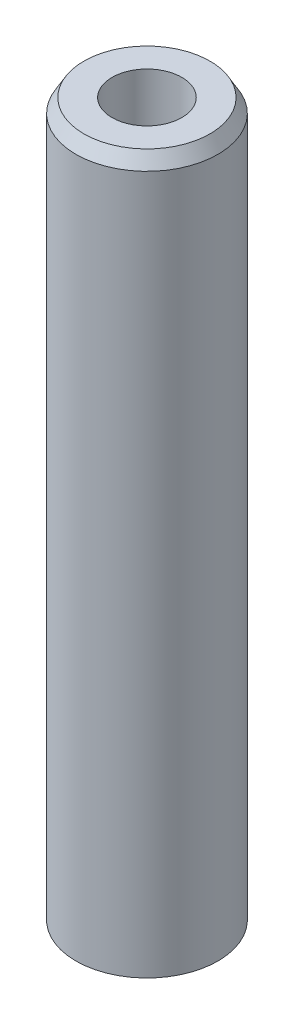
from build123d import *
from OCP.BRepFilletAPI import BRepFilletAPI_MakeChamfer

# Parameters (mm, degrees)
SKETCH1_R           = 10
BOSS_EXTRUDE1_DEPTH = 101.453979882
SKETCH2_R           = 4.914323069
CUT_EXTRUDE1_DEPTH  = 103.434906325
CHAMFER1_SIZE       = 1.940346507
CHAMFER1_SIZE2      = 1.120259578


with BuildPart() as part:
    # Sketch1 → Boss-Extrude1 (new body)
    with BuildSketch(Plane(origin=(0, 0, 0), x_dir=(1, 0, 0), z_dir=(0, 1, 0))):
        Circle(SKETCH1_R)
    extrude(amount=BOSS_EXTRUDE1_DEPTH)

    # Sketch2 → Cut-Extrude1 (cut, through all)
    with BuildSketch(Plane(origin=(0, 0, 0), x_dir=(1, 0, 0), z_dir=(0, 1, 0))):
        Circle(SKETCH2_R)
    extrude(amount=CUT_EXTRUDE1_DEPTH, mode=Mode.SUBTRACT)

    # Chamfer1: one chamfer whose edges measure the first distance from different faces: ONE call of the kernel's chamfer builder (chamfer() names one face for all edges)
    chamfer1_edges_1 = [part.edges().sort_by_distance(p)[0] for p in [
        (-10, 101.453979882, 0),
    ]]
    chamfer1_side_1 = [part.faces().sort_by_distance(p)[0] for p in [
        (-10, 50.726989941, 0),
    ]]
    chamfer1_edges_2 = [part.edges().sort_by_distance(p)[0] for p in [
        (-10, 0, 0),
    ]]
    chamfer1_side_2 = [part.faces().sort_by_distance(p)[0] for p in [
        (-9.717157288, 0, 0),
    ]]
    chamfer1 = BRepFilletAPI_MakeChamfer(part.part.solid().wrapped)
    for e in chamfer1_edges_1:
        chamfer1.Add(CHAMFER1_SIZE, CHAMFER1_SIZE2, e.wrapped, chamfer1_side_1[0].wrapped)  # the first distance lies on this face
    for e in chamfer1_edges_2:
        chamfer1.Add(CHAMFER1_SIZE, CHAMFER1_SIZE2, e.wrapped, chamfer1_side_2[0].wrapped)  # the first distance lies on this face
    add(Compound.cast(chamfer1.Shape()), mode=Mode.REPLACE)


solid = part.part
